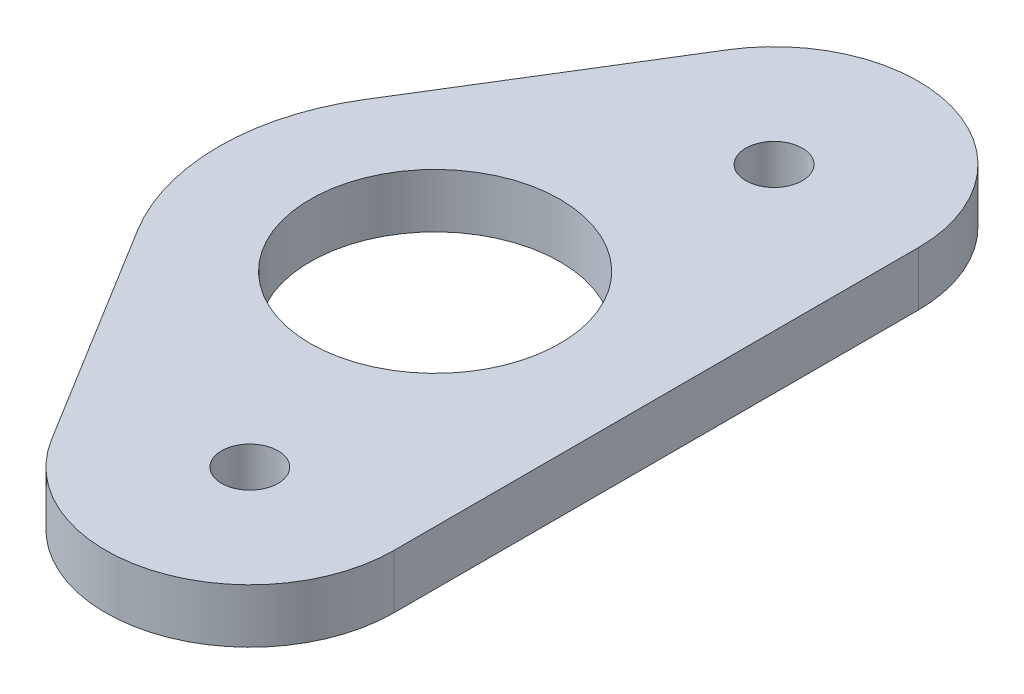
from build123d import *

# Parameters (mm, degrees)
SKETCH1_R           = 11
SKETCH1_R_2         = 2.4892
BOSS_EXTRUDE1_DEPTH = 4.7625


with BuildPart() as part:
    # Sketch1 → Boss-Extrude1 (new body)
    with BuildSketch(Plane(origin=(0, 0, 0), x_dir=(1, 0, 0), z_dir=(0, 1, 0))):
        with BuildLine():
            ThreePointArc((-78.71799706, 9.993951739), (-81.55, 0), (-78.71799706, -9.993951739))
            Line((-78.71799706, -9.993951739), (-66.545030839, -29.74801255))
            ThreePointArc((-66.545030839, -29.74801255), (-52.270546345, -35.304264568), (-43.033032799, -23.085378057))
            Line((-43.033032799, -23.085378057), (-43.033032799, 23.085378057))
            ThreePointArc((-43.033032799, 23.085378057), (-52.270546345, 35.304264568), (-66.545030839, 29.74801255))
            Line((-66.545030839, 29.74801255), (-78.71799706, 9.993951739))
        make_face()
        with Locations((-62.5, 0)):
            Circle(SKETCH1_R, mode=Mode.SUBTRACT)
        with Locations((-55.733032799, 23.085378057)):
            Circle(SKETCH1_R_2, mode=Mode.SUBTRACT)
        with Locations((-55.733032799, -23.085378057)):
            Circle(SKETCH1_R_2, mode=Mode.SUBTRACT)
    extrude(amount=BOSS_EXTRUDE1_DEPTH)


solid = part.part
